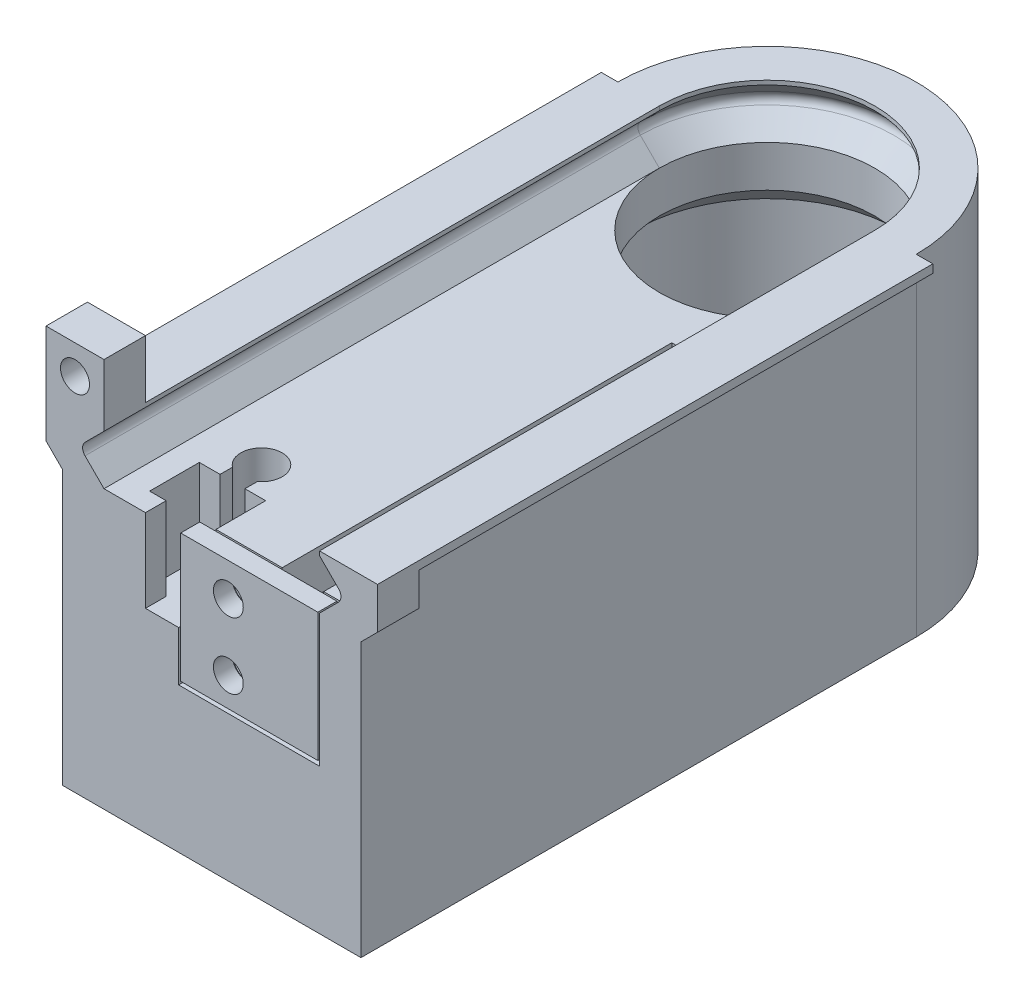
from build123d import *

# Parameters (mm, degrees)
DODANIE_WYCI_GNI_CIE1_DEPTH         = 40
WYTNIJ_WYCI_GNI_CIE1_DEPTH          = 6.5
SZKIC6_R                            = 13
WYTNIJ_WYCI_GNI_CIE2_DEPTH          = 30
SZKIC7_R                            = 16
WYTNIJ_WYCI_GNI_CIE4_DEPTH          = 20
SFAZOWANIE1_SIZE                    = 5
SZKIC8_W                            = 5
SZKIC8_H                            = 47
WYTNIJ_WYCI_GNI_CIE5_DEPTH          = 5
ZAOKR_GLENIE2_R                     = 1
SZKIC10_W                           = 8
SZKIC10_H                           = 6
WYTNIJ_WYCI_GNI_CIE6_DEPTH          = 10
SZKIC26_R                           = 2.5
WYTNIJ_WYCI_GNI_CIE10_DEPTH         = 21
SZKIC12_W                           = 4
SZKIC12_H                           = 2.5
WYTNIJ_WYCI_GNI_CIE8_DEPTH          = 10
DODANIE_WYCI_GNI_CIE2_DEPTH         = 67
SZKIC17_W                           = 17
SZKIC17_H                           = 2.5
WYTNIJ_WYCI_GNI_CIE9_DEPTH          = 16
OTWORY_USTALAJ_CE_4_0MM5_D          = 4
OTWORY_USTALAJ_CE_4_0MM5_DEPTH      = 15
OTWORY_USTALAJ_CE_4_0MM5_TIP        = 1.201721238
SZKIC23_W                           = 16.55
SZKIC23_H                           = 2.3
DODANIE_WYCI_GNI_CIE4_DEPTH         = 15.5
OTWORY_USTALAJ_CE_4_0MM6_AT_2_COUNT = 2
OTWORY_USTALAJ_CE_4_0MM6_AT_2_PITCH = 8
DODANIE_WYCI_GNI_CIE5_DEPTH         = 5
SFAZOWANIE2_SIZE                    = 2
SZKIC29_W                           = 7
SZKIC29_H                           = 7
SZKIC29_R                           = 1.75
DODANIE_WYCI_GNI_CIE6_DEPTH         = 5


# Some blends are built 0.0001 mm under size
with BuildPart() as part:
    # Szkic1 → Dodanie-wyciągnięcie1 (new body)
    with BuildSketch(Plane(origin=(0, 0, 0), x_dir=(1, 0, 0), z_dir=(0, 1, 0))):
        with BuildLine():
            ThreePointArc((18, 33.5), (0, 15.5), (-18, 33.5))
            Line((-18, 33.5), (-18, -33.5))
            Line((-18, -33.5), (18, -33.5))
            Line((18, -33.5), (18, 33.5))
        make_face()
        with BuildLine():
            ThreePointArc((18, 33.5), (0, 51.5), (-18, 33.5))
            Line((-18, 33.5), (18, 33.5))
        make_face()
        with BuildLine():
            Line((18, 33.5), (-18, 33.5))
            ThreePointArc((-18, 33.5), (0, 15.5), (18, 33.5))
        make_face()
    extrude(amount=DODANIE_WYCI_GNI_CIE1_DEPTH)

    # Szkic2 → Wytnij-wyciągnięcie1 (cut)
    with BuildSketch(Plane(origin=(0, 40, 0), x_dir=(1, 0, 0), z_dir=(0, 1, 0))):
        with BuildLine():
            Line((-13, -33.5), (13, -33.5))
            Line((13, -33.5), (13, 33.5))
            ThreePointArc((13, 33.5), (0, 46.5), (-13, 33.5))
            Line((-13, 33.5), (-13, -33.5))
        make_face()
    extrude(amount=-WYTNIJ_WYCI_GNI_CIE1_DEPTH, mode=Mode.SUBTRACT)

    # Wycięcie-wyciągnięcie po ścieżce1: sweep along a path in Szkic5
    with BuildLine(Plane(origin=(0, 40, 0), x_dir=(1, 0, 0), z_dir=(0, 1, 0))) as wyci_cie_wyci_gni_cie_po_cie_ce1_path:
        Line((13, -33.5), (13, 33.5))
        ThreePointArc((13, 33.5), (0, 46.5), (-13, 33.5))
        Line((-13, 33.5), (-13, -33.5))
    # Szkic4 → Wycięcie-wyciągnięcie po ścieżce1 (sweep, cut)
    with BuildSketch(Plane.XY.offset(33.5)):
        Polygon((13, 33.5), (16, 36.5), (13, 39.5), align=None)
    sweep(path=wyci_cie_wyci_gni_cie_po_cie_ce1_path.line, mode=Mode.SUBTRACT)

    # Szkic6 → Wytnij-wyciągnięcie2 (cut)
    with BuildSketch(Plane(origin=(0, 33.5, 0), x_dir=(1, 0, 0), z_dir=(0, 1, 0))):
        with Locations(Location((0, 33.5, 0), (0, 0, 270))):
            Circle(SZKIC6_R)
    extrude(amount=-WYTNIJ_WYCI_GNI_CIE2_DEPTH, mode=Mode.SUBTRACT)

    # Szkic7 → Wytnij-wyciągnięcie4 (cut)
    with BuildSketch(Plane(origin=(0, 3.5, 0), x_dir=(1, 0, 0), z_dir=(0, 1, 0))):
        with Locations(Location((0, 33.5, 0), (0, 0, 270))):
            Circle(SZKIC7_R)
    extrude(amount=WYTNIJ_WYCI_GNI_CIE4_DEPTH, mode=Mode.SUBTRACT)

    # Sfazowanie1
    # the kernel refuses this chamfer: 5 mm, written as the material it takes off along each edge
    with BuildSketch(Plane(origin=(0, 23.5, -33.5), x_dir=(0, 0, 1), z_dir=(-1, 0, 0))) as sfazowanie1_piece_1_section:
        Polygon((13, SFAZOWANIE1_SIZE), (13 + SFAZOWANIE1_SIZE, 0), (13, 0), align=None)
    sfazowanie1_piece_1 = revolve(axis=Axis((0, 23.5, -33.5), (0, 1, 0)), mode=Mode.PRIVATE)
    sfazowanie1_piece_1 = sfazowanie1_piece_1 & Plane(origin=(0, 26.999564764, -33.5), x_dir=(0, 0, 1), z_dir=(0, -1, 0)) * Cylinder(16, 72, mode=Mode.PRIVATE)
    add(sfazowanie1_piece_1, mode=Mode.SUBTRACT)

    # Szkic8 → Wytnij-wyciągnięcie5 (cut)
    with BuildSketch(Plane(origin=(0, 33.5, 0), x_dir=(1, 0, 0), z_dir=(0, 1, 0))):
        with Locations((8.5, -7.5)):
            Rectangle(SZKIC8_W, SZKIC8_H)
    extrude(amount=-WYTNIJ_WYCI_GNI_CIE5_DEPTH, mode=Mode.SUBTRACT)

    # Zaokrąglenie2
    zaokr_glenie2_edges = [part.edges().sort_by_distance(p)[0] for p in [
        (16, 36.5, 0),
        (0, 36.5, -49.5),
        (-16, 36.5, 0),
    ]]
    fillet(zaokr_glenie2_edges, radius=ZAOKR_GLENIE2_R)

    # Szkic10 → Wytnij-wyciągnięcie6 (cut)
    with BuildSketch(Plane(origin=(0, 33.5, 0), x_dir=(1, 0, 0), z_dir=(0, 1, 0))):
        with Locations((-6, -28)):
            Rectangle(SZKIC10_W, SZKIC10_H)
        with BuildLine():
            ThreePointArc((-7.5, -23.5), (-6, -24), (-4.5, -23.5))
            Line((-4.5, -23.5), (-7.5, -23.5))
        make_face()
        with BuildLine():
            Line((-7.5, -23.5), (-4.5, -23.5))
            ThreePointArc((-4.5, -23.5), (-3.763932023, -22.618033989), (-3.5, -21.5))
            ThreePointArc((-3.5, -21.5), (-7.118033989, -19.263932023), (-7.5, -23.5))
        make_face()
        with BuildLine():
            Line((-7.5, -25), (-4.5, -25))
            Line((-4.5, -25), (-4.5, -23.5))
            ThreePointArc((-4.5, -23.5), (-6, -24), (-7.5, -23.5))
            Line((-7.5, -23.5), (-7.5, -25))
        make_face()
    extrude(amount=-WYTNIJ_WYCI_GNI_CIE6_DEPTH, mode=Mode.SUBTRACT)

    # Szkic26 → Wytnij-wyciągnięcie10 (cut)
    with BuildSketch(Plane(origin=(0, 23.5, 0), x_dir=(1, 0, 0), z_dir=(0, 1, 0))):
        with Locations(Location((-6, -21.5, 0), (0, 0, 270))):
            Circle(SZKIC26_R)
    extrude(amount=-WYTNIJ_WYCI_GNI_CIE10_DEPTH, mode=Mode.SUBTRACT)

    # Szkic12 → Wytnij-wyciągnięcie8 (cut)
    with BuildSketch(Plane(origin=(0, 33.5, 0), x_dir=(1, 0, 0), z_dir=(0, 1, 0))):
        with Locations((-6, -32.25)):
            Rectangle(SZKIC12_W, SZKIC12_H)
    extrude(amount=-WYTNIJ_WYCI_GNI_CIE8_DEPTH, mode=Mode.SUBTRACT)

    # Szkic13 → Dodanie-wyciągnięcie2 (add)
    with BuildSketch(Plane.XY.offset(33.5)):
        Polygon((-18, 40), (-20, 40), (-20, 39), (-18, 37), align=None)
        Polygon((18, 37), (18, 40), (20, 40), (20, 39), align=None)
    extrude(amount=-DODANIE_WYCI_GNI_CIE2_DEPTH)

    # Szkic17 → Wytnij-wyciągnięcie9 (cut)
    with BuildSketch(Plane(origin=(0, 33.5, 0), x_dir=(1, 0, 0), z_dir=(0, 1, 0))):
        with Locations((4.5, -32.25)):
            Rectangle(SZKIC17_W, SZKIC17_H)
    extrude(amount=-WYTNIJ_WYCI_GNI_CIE9_DEPTH, mode=Mode.SUBTRACT)

    # Otwory ustalające Ø4.0mm5
    with Locations(Plane.XY.offset(31)):
        with Locations((2, 29.5), (2, 21.5)):
            Hole(OTWORY_USTALAJ_CE_4_0MM5_D / 2, depth=OTWORY_USTALAJ_CE_4_0MM5_DEPTH)
            with Locations((0, 0, -(OTWORY_USTALAJ_CE_4_0MM5_DEPTH + OTWORY_USTALAJ_CE_4_0MM5_TIP / 2))):  # 118° drill point
                Cone(0, OTWORY_USTALAJ_CE_4_0MM5_D / 2, OTWORY_USTALAJ_CE_4_0MM5_TIP, mode=Mode.SUBTRACT)

    # Szkic27 → Dodanie-wyciągnięcie5 (add)
    with BuildSketch(Plane.XY.offset(33.5)):
        Polygon((-20, 39), (-20, 35), (-18, 35), (-18, 37), align=None)
        Polygon((18, 37), (20, 39), (20, 35), (18, 35), align=None)
    extrude(amount=-DODANIE_WYCI_GNI_CIE5_DEPTH)

    # Sfazowanie2
    sfazowanie2_edges = [part.edges().sort_by_distance(p)[0] for p in [
        (18, 35, 31),
        (-18, 35, 31),
    ]]
    chamfer(sfazowanie2_edges, length=SFAZOWANIE2_SIZE - 0.0001)  # a hair under: the kernel refuses the full size

    # Szkic29 → Dodanie-wyciągnięcie6 (add)
    with BuildSketch(Plane(origin=(0, 0, 28.5), x_dir=(-1, 0, 0), z_dir=(0, 0, -1))):
        with Locations((16.5, 43.5)):
            Rectangle(SZKIC29_W, SZKIC29_H)
        with Locations((16.5, 43.5)):
            Circle(SZKIC29_R, mode=Mode.SUBTRACT)
    extrude(amount=-DODANIE_WYCI_GNI_CIE6_DEPTH)


with BuildPart() as body_2:
    # Szkic23 → Dodanie-wyciągnięcie4 (new body)
    with BuildSketch(Plane(origin=(0, 33.5, 0), x_dir=(1, 0, 0), z_dir=(0, 1, 0))):
        with Locations((4.525, -32.35)):
            Rectangle(SZKIC23_W, SZKIC23_H)
    extrude(amount=-DODANIE_WYCI_GNI_CIE4_DEPTH)

    # Szkic25 → Otwory ustalające Ø4.0mm6 (revolve, cut)
    with BuildSketch(Plane(origin=(2, 21.5, 33.5), x_dir=(0, -1, 0), z_dir=(1, 0, 0))):
        Polygon((0, 0), (0, 16.081549114), (1.8, 15), (1.8, 0), align=None)
    otwory_ustalaj_ce_4_0mm6 = revolve(axis=Axis((2, 21.5, 39.85), (0, 0, -1)), mode=Mode.SUBTRACT)

    # Otwory ustalające Ø4.0mm6 at 2: Otwory ustalające Ø4.0mm6 ×2
    with Locations(*[(0, i * OTWORY_USTALAJ_CE_4_0MM6_AT_2_PITCH, 0) for i in range(1, OTWORY_USTALAJ_CE_4_0MM6_AT_2_COUNT)]):
        add(otwory_ustalaj_ce_4_0mm6, mode=Mode.SUBTRACT)


solid = Compound([part.part, body_2.part])
